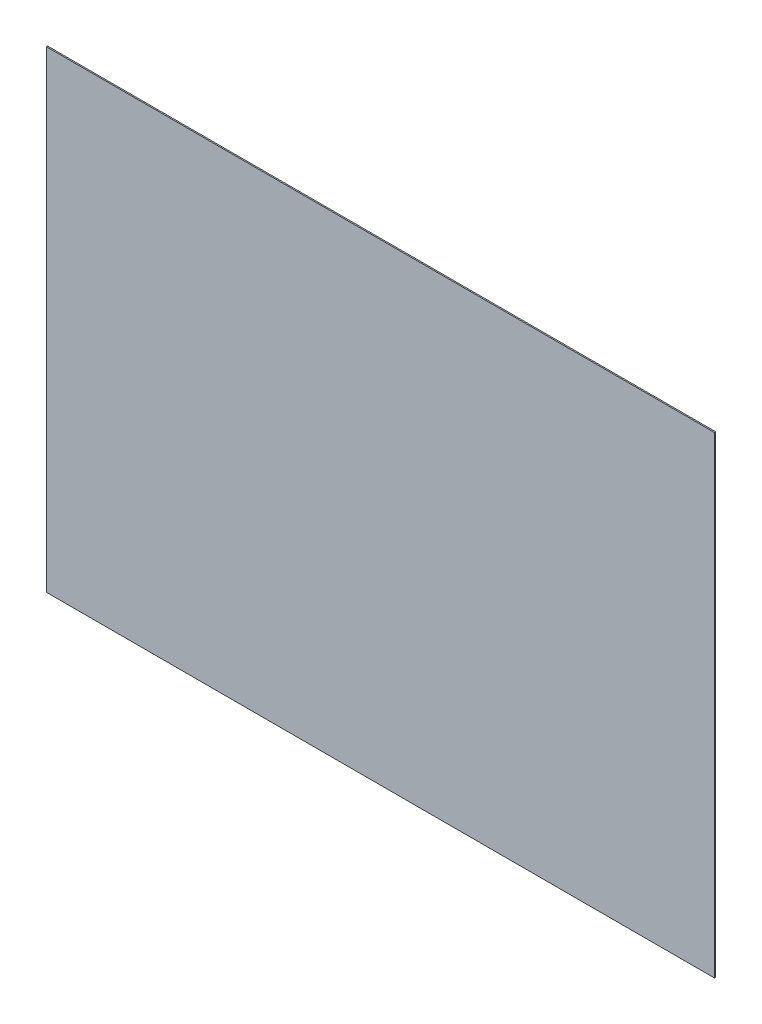
from build123d import *

# Parameters (mm, degrees)
ESBO_O1_W          = 420
ESBO_O1_H          = 297
FLANGE_BASE1_DEPTH = 0.77


# Sheet-metal steps are written as plain solids
with BuildPart() as part:
    # Esboço1 → Flange-base1 (new body)
    with BuildSketch(Plane.XY):
        Rectangle(ESBO_O1_W, ESBO_O1_H)
    extrude(amount=-FLANGE_BASE1_DEPTH)


solid = part.part
